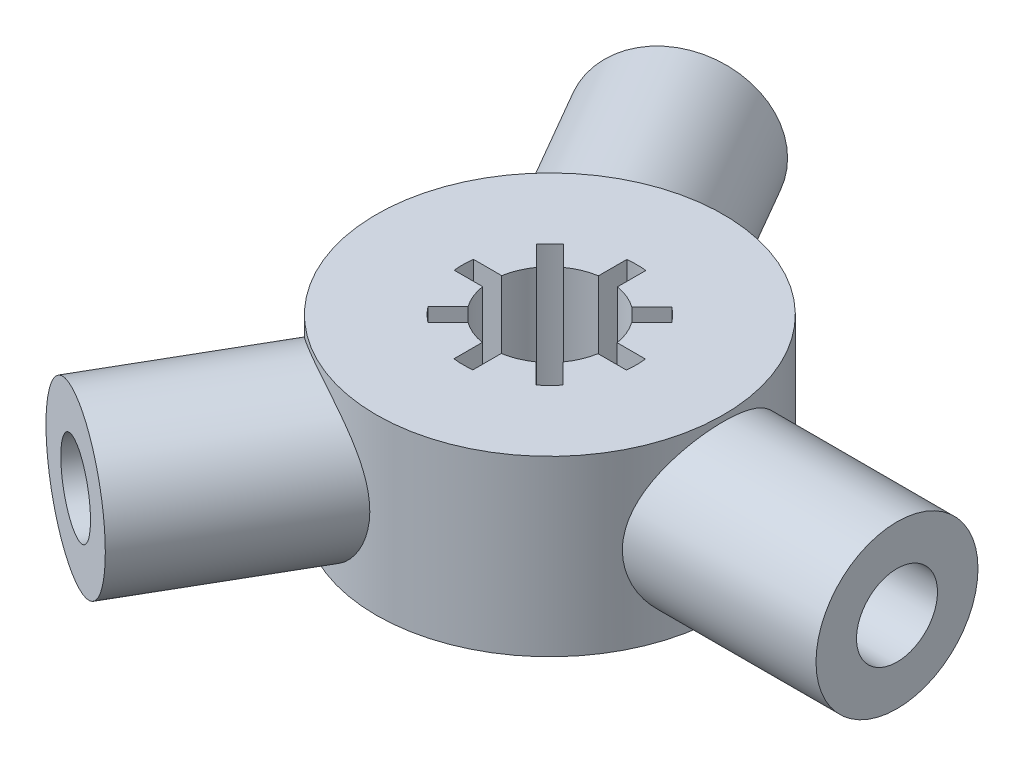
from build123d import *

# Parameters (mm, degrees)
SKETCH1_R                 = 15
BOSS_EXTRUDE1_DEPTH       = 7.5
BOSS_EXTRUDE2_START       = 13
SKETCH3_R                 = 7
SKETCH3_R_2               = 5
BOSS_EXTRUDE2_DEPTH       = 17
SKETCH3_4_R               = 3.5
SKETCH3_4_R_2             = 5
BOSS_EXTRUDE3_DEPTH       = 14
BOSS_EXTRUDE4_START       = 25
BOSS_EXTRUDE4_OUTLINE_R   = 5
BOSS_EXTRUDE4_OUTLINE_R_2 = 3.5
BOSS_EXTRUDE4_DEPTH       = 5
CIRPATTERN14_COUNT        = 3
CUT_EXTRUDE5_DEPTH        = 45.655518692


# Read off the part's stored shape, not the designer's step: Boss-Extrude4
with BuildPart() as part:
    # Sketch1 → Boss-Extrude1 (new, symmetric)
    with BuildSketch(Plane(origin=(0, 0, 0), x_dir=(1, 0, 0), z_dir=(0, 1, 0))):
        with Locations(Location((0, 0, 0), (0, 0, 270))):
            Circle(SKETCH1_R)
    extrude(amount=BOSS_EXTRUDE1_DEPTH, both=True)

    # Sketch3 → Boss-Extrude2 (add)
    with BuildSketch(Plane(origin=(0, 0, 0), x_dir=(0, 0, -1), z_dir=(1, 0, 0)).offset(BOSS_EXTRUDE2_START)):
        with Locations(Location((0, 0, 0), (0, 0, 180))):
            Circle(SKETCH3_R)
        with Locations(Location((0, 0, 0), (0, 0, 180))):
            Circle(SKETCH3_R_2, mode=Mode.SUBTRACT)
    boss_extrude2 = extrude(amount=BOSS_EXTRUDE2_DEPTH)

    # Sketch3<4> → Boss-Extrude3 (add)
    with BuildSketch(Plane(origin=(0, 0, 0), x_dir=(0, 0, -1), z_dir=(1, 0, 0))):
        Circle(SKETCH3_4_R)
        with Locations(Location((0, 0, 0), (0, 0, 180))):
            Circle(SKETCH3_4_R_2)
    boss_extrude3 = extrude(amount=BOSS_EXTRUDE3_DEPTH)

    # Boss-Extrude4 outline → Boss-Extrude4 (add)
    with BuildSketch(Plane(origin=(0, 0, 0), x_dir=(0, 0, -1), z_dir=(1, 0, 0)).offset(BOSS_EXTRUDE4_START)):
        Circle(BOSS_EXTRUDE4_OUTLINE_R)
        Circle(BOSS_EXTRUDE4_OUTLINE_R_2, mode=Mode.SUBTRACT)
    boss_extrude4 = extrude(amount=BOSS_EXTRUDE4_DEPTH)

    # CirPattern14: Boss-Extrude2, Boss-Extrude3, Boss-Extrude4 ×3 about axis
    cirpattern14_axis = Axis((0, -7.5, 0), (0, 1, 0))
    add([boss_extrude2.rotate(cirpattern14_axis, i * 360 / CIRPATTERN14_COUNT) for i in range(1, CIRPATTERN14_COUNT)])
    add([boss_extrude3.rotate(cirpattern14_axis, i * 360 / CIRPATTERN14_COUNT) for i in range(1, CIRPATTERN14_COUNT)])
    add([boss_extrude4.rotate(cirpattern14_axis, i * 360 / CIRPATTERN14_COUNT) for i in range(1, CIRPATTERN14_COUNT)])

    # Sketch4 → Cut-Extrude5 (cut, through all)
    with BuildSketch(Plane(origin=(0, 7.5, 0), x_dir=(1, 0, 0), z_dir=(0, 1, 0))):
        with BuildLine():
            ThreePointArc((5.864590062, 4.675102502), (5.315335108, 5.29123924), (4.701700296, 5.843287972))
            Line((4.701700296, 5.843287972), (2.968685581, 4.110273257))
            ThreePointArc((2.968685581, 4.110273257), (1.956146698, 4.677705679), (0.84109472, 5))
            Line((0.84109472, 5), (0.84109472, 7.452688084))
            ThreePointArc((0.84109472, 7.452688084), (0.017038352, 7.499980646), (-0.807224387, 7.456432712))
            Line((-0.807224387, 7.456432712), (-0.807224387, 5.005579798))
            ThreePointArc((-0.807224387, 5.005579798), (-1.924432811, 4.690842002), (-2.940790126, 4.130277686))
            Line((-2.940790126, 4.130277686), (-4.675102502, 5.864590062))
            ThreePointArc((-4.675102502, 5.864590062), (-5.29123924, 5.315335108), (-5.843287972, 4.701700296))
            Line((-5.843287972, 4.701700296), (-4.110273257, 2.968685581))
            ThreePointArc((-4.110273257, 2.968685581), (-4.677705679, 1.956146698), (-5, 0.84109472))
            Line((-5, 0.84109472), (-7.452688084, 0.84109472))
            ThreePointArc((-7.452688084, 0.84109472), (-7.499980646, 0.017038352), (-7.456432712, -0.807224387))
            Line((-7.456432712, -0.807224387), (-5.005579798, -0.807224387))
            ThreePointArc((-5.005579798, -0.807224387), (-4.690842002, -1.924432811), (-4.130277686, -2.940790126))
            Line((-4.130277686, -2.940790126), (-5.864590062, -4.675102502))
            ThreePointArc((-5.864590062, -4.675102502), (-5.315335108, -5.29123924), (-4.701700296, -5.843287972))
            Line((-4.701700296, -5.843287972), (-2.968685581, -4.110273257))
            ThreePointArc((-2.968685581, -4.110273257), (-1.956146698, -4.677705679), (-0.84109472, -5))
            Line((-0.84109472, -5), (-0.84109472, -7.452688084))
            ThreePointArc((-0.84109472, -7.452688084), (-0.017038352, -7.499980646), (0.807224387, -7.456432712))
            Line((0.807224387, -7.456432712), (0.807224387, -5.005579798))
            ThreePointArc((0.807224387, -5.005579798), (1.924432811, -4.690842002), (2.940790126, -4.130277686))
            Line((2.940790126, -4.130277686), (4.675102502, -5.864590062))
            ThreePointArc((4.675102502, -5.864590062), (5.29123924, -5.315335108), (5.843287972, -4.701700296))
            Line((5.843287972, -4.701700296), (4.110273257, -2.968685581))
            ThreePointArc((4.110273257, -2.968685581), (4.677705679, -1.956146698), (5, -0.84109472))
            Line((5, -0.84109472), (7.452688084, -0.84109472))
            ThreePointArc((7.452688084, -0.84109472), (7.499980646, -0.017038352), (7.456432712, 0.807224387))
            Line((7.456432712, 0.807224387), (5.005579798, 0.807224387))
            ThreePointArc((5.005579798, 0.807224387), (4.690842002, 1.924432811), (4.130277686, 2.940790126))
            Line((4.130277686, 2.940790126), (5.864590062, 4.675102502))
        make_face()
    extrude(amount=-CUT_EXTRUDE5_DEPTH, mode=Mode.SUBTRACT)


solid = part.part
